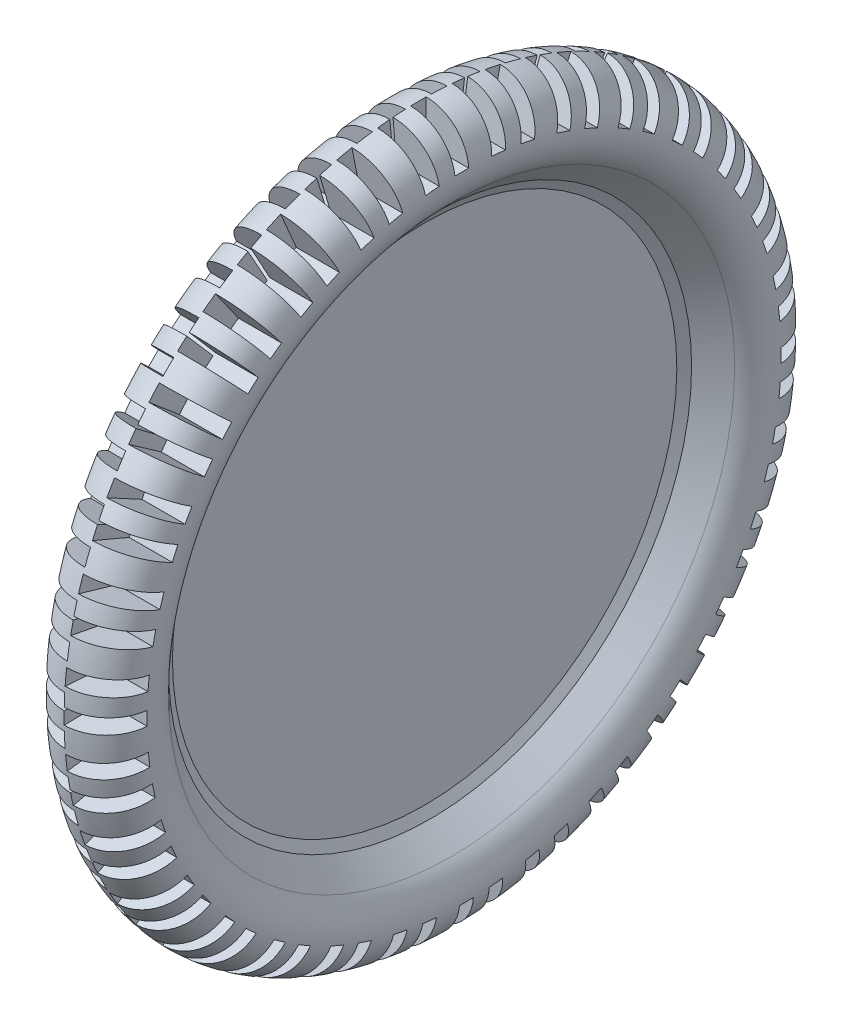
from build123d import *

# Parameters (mm, degrees)
SKETCH3_R           = 6
BOSS_EXTRUDE1_DEPTH = 12
CUT_EXTRUDE1_DEPTH  = 72.158608984
CUT_EXTRUDE2_DEPTH  = 72.158608984
CIRPATTERN1_COUNT   = 30


with BuildPart() as part:
    # Sketch2 → Revolve1 (revolve)
    with BuildSketch(Plane(origin=(0, 0, 0), x_dir=(1, 0, 0), z_dir=(0, 1, 0))):
        with BuildLine():
            Line((0.5, 0), (-0.5, 0))
            Line((-0.5, 0), (-0.5, 35))
            Line((-0.5, 35), (-1.25, 36.299038106))
            Line((-1.25, 36.299038106), (-4.242640687, 39.291678793))
            ThreePointArc((-4.242640687, 39.291678793), (0, 49.53431948), (4.242640687, 39.291678793))
            Line((4.242640687, 39.291678793), (1.25, 36.299038106))
            Line((1.25, 36.299038106), (0.5, 35))
            Line((0.5, 35), (0.5, 0))
        make_face()
    revolve(axis=Axis((0.5, 0, 0), (-1, 0, 0)))

    # Sketch3 → Boss-Extrude1 (add)
    with BuildSketch(Plane.ZY.offset(0.5)):
        Circle(SKETCH3_R)
        with BuildLine():
            Line((-3, 2.645751311), (-3, -2.645751311))
            ThreePointArc((-3, -2.645751311), (4, 0), (-3, 2.645751311))
        make_face(mode=Mode.SUBTRACT)
    extrude(amount=BOSS_EXTRUDE1_DEPTH)

    # Sketch5 → Cut-Extrude1 (cut, through all)
    with BuildSketch(Plane(origin=(0, 0, 0), x_dir=(0, 0, -1), z_dir=(1, 0, 0))):
        with BuildLine():
            Line((-3.834852681, 43.832566716), (-4.357787137, 49.809734905))
            ThreePointArc((-4.357787137, 49.809734905), (-3.270156462, 49.892946162), (-2.180969368, 49.952411079))
            Line((-2.180969368, 49.952411079), (-1.919253044, 43.95812175))
            ThreePointArc((-1.919253044, 43.95812175), (-2.877737686, 43.905792622), (-3.834852681, 43.832566716))
        make_face()
        with BuildLine():
            Line((3.632898536, 49.867845835), (3.196950712, 43.883704335))
            ThreePointArc((3.196950712, 43.883704335), (2.238871959, 43.943002314), (1.279727625, 43.981385804))
            Line((1.279727625, 43.981385804), (1.454235937, 49.978847504))
            ThreePointArc((1.454235937, 49.978847504), (2.544172681, 49.935229902), (3.632898536, 49.867845835))
        make_face()
    cut_extrude1 = extrude(amount=-CUT_EXTRUDE1_DEPTH, mode=Mode.SUBTRACT)

    # Sketch5<3> → Cut-Extrude2 (cut, through all)
    with BuildSketch(Plane(origin=(0, 0, 0), x_dir=(0, 0, -1), z_dir=(1, 0, 0))):
        with BuildLine():
            Line((0.727194883, 49.994711596), (0.639931497, 43.995346205))
            ThreePointArc((0.639931497, 43.995346205), (-0.319974209, 43.998836536), (-1.279727625, 43.981385804))
            Line((-1.279727625, 43.981385804), (-1.454235937, 49.978847504))
            ThreePointArc((-1.454235937, 49.978847504), (-0.363607056, 49.998677882), (0.727194883, 49.994711596))
        make_face()
        with BuildLine():
            Line((6.526309611, 49.572243069), (5.743152458, 43.6235739))
            ThreePointArc((5.743152458, 43.6235739), (4.790142493, 43.738478882), (3.834852681, 43.832566716))
            Line((3.834852681, 43.832566716), (4.357787137, 49.809734905))
            ThreePointArc((4.357787137, 49.809734905), (5.443343743, 49.702816911), (6.526309611, 49.572243069))
        make_face()
    cut_extrude2 = extrude(amount=CUT_EXTRUDE2_DEPTH, mode=Mode.SUBTRACT)

    # CirPattern1: Cut-Extrude1, Cut-Extrude2 ×30 about axis
    cirpattern1_axis = Axis((0.5, 0, 0), (-1, 0, 0))
    add([cut_extrude1.rotate(cirpattern1_axis, i * 360 / CIRPATTERN1_COUNT) for i in range(1, CIRPATTERN1_COUNT)], mode=Mode.SUBTRACT)
    add([cut_extrude2.rotate(cirpattern1_axis, i * 360 / CIRPATTERN1_COUNT) for i in range(1, CIRPATTERN1_COUNT)], mode=Mode.SUBTRACT)


solid = part.part
